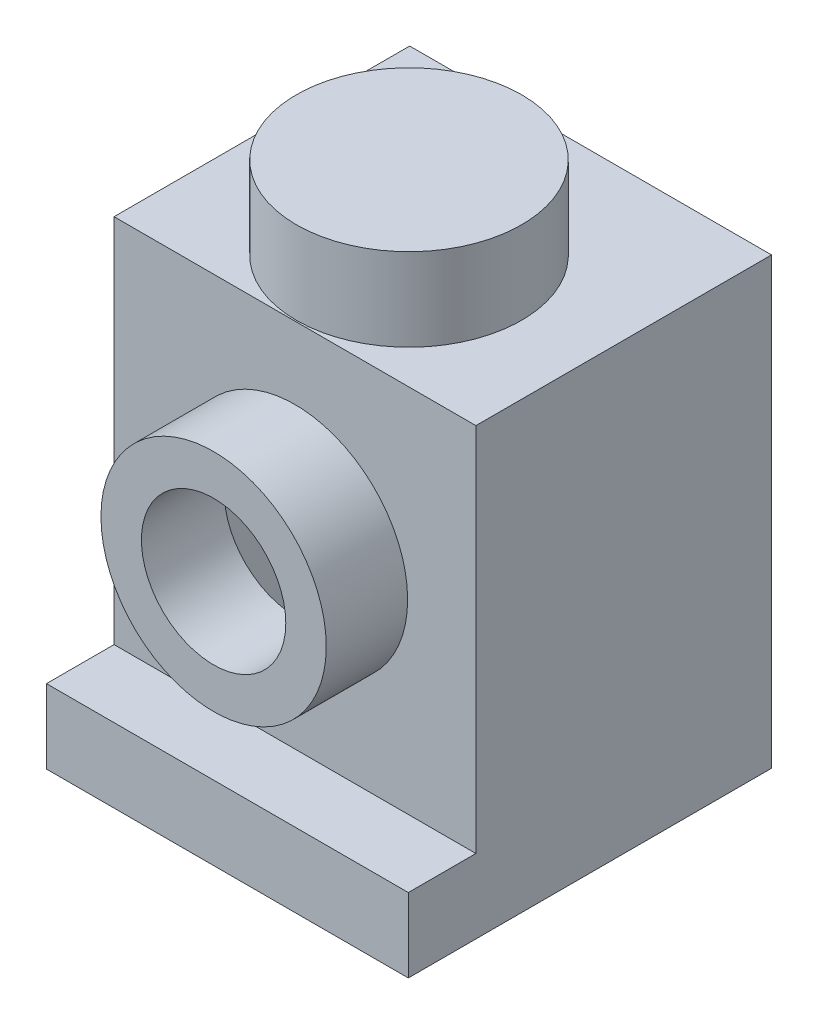
from build123d import *
from build123d.topology import SkipClean

# Parameters (mm, degrees)
BOSS_EXTRUDE1_DEPTH = 7.87
SKETCH2_R           = 2.45
BOSS_EXTRUDE2_DEPTH = 1.8
SKETCH3_R           = 2.45
SKETCH3_R_2         = 1.57
BOSS_EXTRUDE3_DEPTH = 1.77
SKETCH4_R           = 1.57
CUT_EXTRUDE1_DEPTH  = 16.324578298
SKETCH5_W           = 4.87
SKETCH5_H           = 4.81
CUT_EXTRUDE2_DEPTH  = 4.92
SKETCH6_W           = 4.97
SKETCH6_H           = 4.9
CUT_EXTRUDE3_DEPTH  = 8.81
SHELL1_START        = 8.81
SHELL1_OUTLINE_R    = 0.95
SHELL1_DEPTH        = 1.16


# Read off the part's stored shape, not the designer's step: Shell1
with BuildPart() as part:
    # Sketch1 → Boss-Extrude1 (new body)
    with BuildSketch(Plane(origin=(0, 0, 0), x_dir=(0, 0, -1), z_dir=(1, 0, 0))):
        Polygon((0, 0), (0, 9.67), (-6.43, 9.67), (-6.43, 1.61), (-7.9, 1.61), (-7.9, 0), align=None)
    extrude(amount=-BOSS_EXTRUDE1_DEPTH)

    # Sketch2 → Boss-Extrude2 (add)
    with BuildSketch(Plane(origin=(0, 9.67, 0), x_dir=(1, 0, 0), z_dir=(0, 1, 0))):
        with Locations(Location((-3.935, -3.95, 0), (0, 0, 270))):
            Circle(SKETCH2_R)
    extrude(amount=BOSS_EXTRUDE2_DEPTH)

    # Sketch3 → Boss-Extrude3 (add)
    with BuildSketch(Plane.XY.offset(6.43)):
        with Locations((-3.935, 5.65)):
            Circle(SKETCH3_R)
        with Locations(Location((-3.935, 5.65, 0), (0, 0, 270))):
            Circle(SKETCH3_R_2, mode=Mode.SUBTRACT)
    extrude(amount=BOSS_EXTRUDE3_DEPTH)

    # Sketch4 → Cut-Extrude1 (cut, through all)
    with SkipClean():  # the faces are left unmerged after this step: merging them gives an invalid solid
        with BuildSketch(Plane.XY.offset(6.43)):
            with Locations((-3.935, 5.65)):
                Circle(SKETCH4_R)
        extrude(amount=-CUT_EXTRUDE1_DEPTH, mode=Mode.SUBTRACT)

    # Sketch5 → Cut-Extrude2 (cut)
    with SkipClean():  # the faces are left unmerged after this step: merging them gives an invalid solid
        with BuildSketch(Plane(origin=(0, 0, 0), x_dir=(-1, 0, 0), z_dir=(0, 0, -1))):
            with Locations((3.935, 5.705)):
                Rectangle(SKETCH5_W, SKETCH5_H)
        extrude(amount=-CUT_EXTRUDE2_DEPTH, mode=Mode.SUBTRACT)

    # Sketch6 → Cut-Extrude3 (cut)
    with SkipClean():  # the faces are left unmerged after this step: merging them gives an invalid solid
        with BuildSketch(Plane.XZ):
            with Locations((-3.935, 3.95)):
                Rectangle(SKETCH6_W, SKETCH6_H)
        extrude(amount=-CUT_EXTRUDE3_DEPTH, mode=Mode.SUBTRACT)

    # Shell1 outline → Shell1 (cut)
    with SkipClean():  # the faces are left unmerged after this step: merging them gives an invalid solid
        with BuildSketch(Plane(origin=(0, 0, 0), x_dir=(1, 0, 0), z_dir=(0, 1, 0)).offset(SHELL1_START)):
            with Locations((-3.935, -3.95)):
                Circle(SHELL1_OUTLINE_R)
        extrude(amount=SHELL1_DEPTH, mode=Mode.SUBTRACT)


solid = part.part
